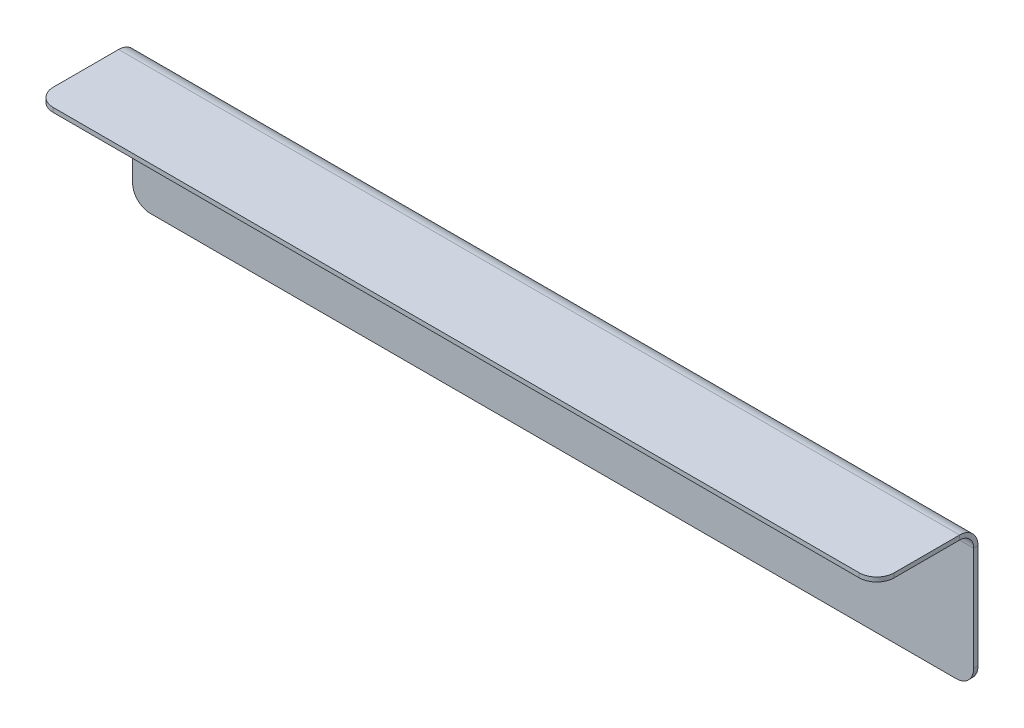
from build123d import *

# Parameters (mm, degrees)
SKETCH1_W                    = 304.8
SKETCH1_H                    = 1.5875
BASE_FLANGE1_DEPTH           = 50.8
EDGE_FLANGE1_STRIP_W         = 16.51
EDGE_FLANGE1_STRIP_H         = 1.5875
EDGE_FLANGE1_STRIP_CUT_DEPTH = 304.8
EDGE_FLANGE1_DEPTH           = 304.8
SKETCH10_R                   = 2.38125
CUT_EXTRUDE1_DEPTH           = 165.439625502
FILLET1_R                    = 6.35


# Sheet-metal steps are written as plain solids
with BuildPart() as part:
    # Sketch1 → Base-Flange1 (new body)
    with BuildSketch(Plane(origin=(0, 0, 0), x_dir=(1, 0, 0), z_dir=(0, 1, 0))):
        with Locations((0, -0.79375)):
            Rectangle(SKETCH1_W, SKETCH1_H)
    extrude(amount=BASE_FLANGE1_DEPTH)

    # Edge-Flange1 strip (across the edge) → Edge-Flange1 strip cut (cut)
    with BuildSketch(Plane(origin=(152.4, 50.8, 1.5875), x_dir=(0, -1, 0), z_dir=(-1, 0, 0))):
        with Locations((-1.5875, -0.79375)):
            Rectangle(EDGE_FLANGE1_STRIP_W, EDGE_FLANGE1_STRIP_H)
    extrude(amount=EDGE_FLANGE1_STRIP_CUT_DEPTH, mode=Mode.SUBTRACT)

    # Edge-Flange1 section (across the edge) → Edge-Flange1 (add)
    with BuildSketch(Plane(origin=(152.4, 50.8, 1.5875), x_dir=(0, -1, 0), z_dir=(-1, 0, 0))):
        with BuildLine():
            Line((0, 5.08), (0, 35.1282))
            Line((0, 35.1282), (1.5875, 35.1282))
            Line((1.5875, 35.1282), (1.5875, 5.08))
            ThreePointArc((1.5875, 5.08), (3.075397552, 1.487897552), (6.6675, 0))
            Line((6.6675, 0), (6.6675, -1.5875))
            ThreePointArc((6.6675, -1.5875), (1.952865536, 0.365365536), (0, 5.08))
        make_face()
    extrude(amount=EDGE_FLANGE1_DEPTH)

    # Sketch10 → Cut-Extrude1 (cut, through all)
    with BuildSketch(Plane.XY.offset(1.5875)):
        with Locations((-114.3, 19.05)):
            Circle(SKETCH10_R)
        with Locations((114.3, 19.05)):
            Circle(SKETCH10_R)
        with Locations((0, 19.05)):
            Circle(SKETCH10_R)
        with Locations((57.15, 19.05)):
            Circle(SKETCH10_R)
        with Locations((-57.15, 19.05)):
            Circle(SKETCH10_R)
    extrude(amount=-CUT_EXTRUDE1_DEPTH, mode=Mode.SUBTRACT)

    # Fillet1
    fillet1_edges = [part.edges().sort_by_distance(p)[0] for p in [
        (152.4, 50.00625, 36.7157),
        (-152.4, 50.00625, 36.7157),
        (-152.4, 0, 0.79375),
        (152.4, 0, 0.79375),
    ]]
    fillet(fillet1_edges, radius=FILLET1_R)


solid = part.part
